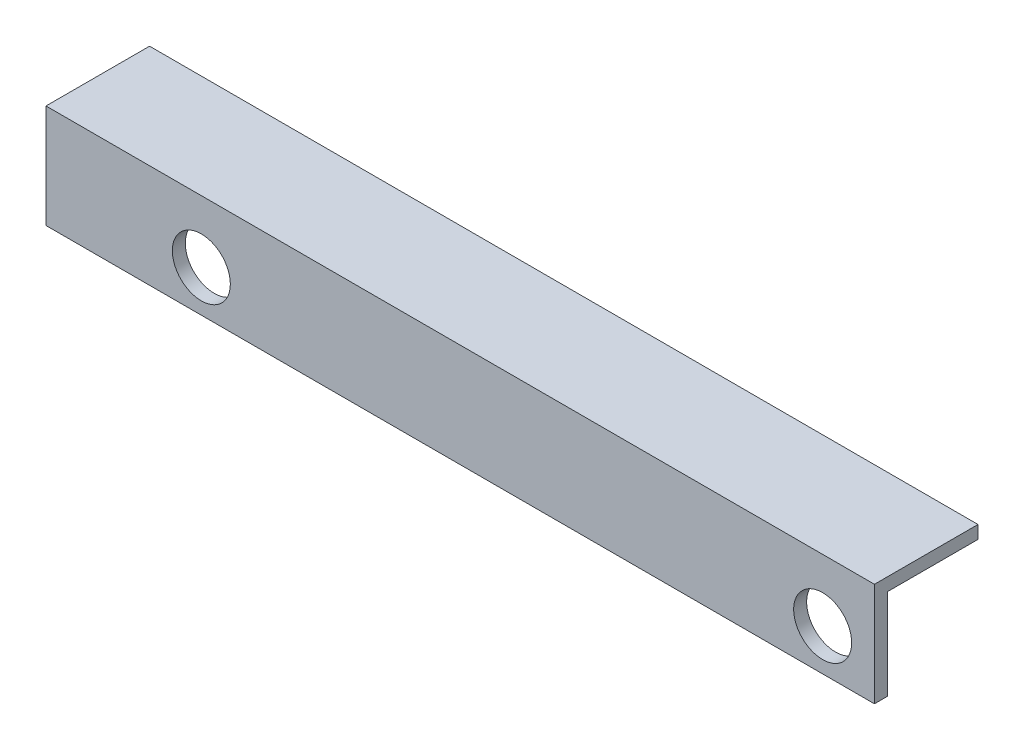
from build123d import *

# Parameters (mm, degrees)
BOSS_EXTRUDE1_DEPTH      = 44.45
BOSS_EXTRUDE1_DEPTH_BACK = 57.15
SKETCH3_R                = 3.556
CUT_EXTRUDE1_DEPTH       = 60.905780189


with BuildPart() as part:
    # Sketch1 → Boss-Extrude1 (new, two sides: drawn at the far end of the back side and taken through both)
    with BuildSketch(Plane(origin=(0, 0, 0), x_dir=(0, 0, -1), z_dir=(1, 0, 0)).offset(-BOSS_EXTRUDE1_DEPTH_BACK)):
        Polygon((0, 0), (0, 12.7), (12.7, 12.7), (12.7, 11.1125), (1.5875, 11.1125), (1.5875, 0), align=None)
    extrude(amount=BOSS_EXTRUDE1_DEPTH + BOSS_EXTRUDE1_DEPTH_BACK)

    # Sketch3 → Cut-Extrude1 (cut, through all)
    with BuildSketch(Plane.XY):
        with Locations((-38.1, 5.08)):
            Circle(SKETCH3_R)
        with Locations((38.1, 5.08)):
            Circle(SKETCH3_R)
    extrude(amount=-CUT_EXTRUDE1_DEPTH, mode=Mode.SUBTRACT)


solid = part.part
